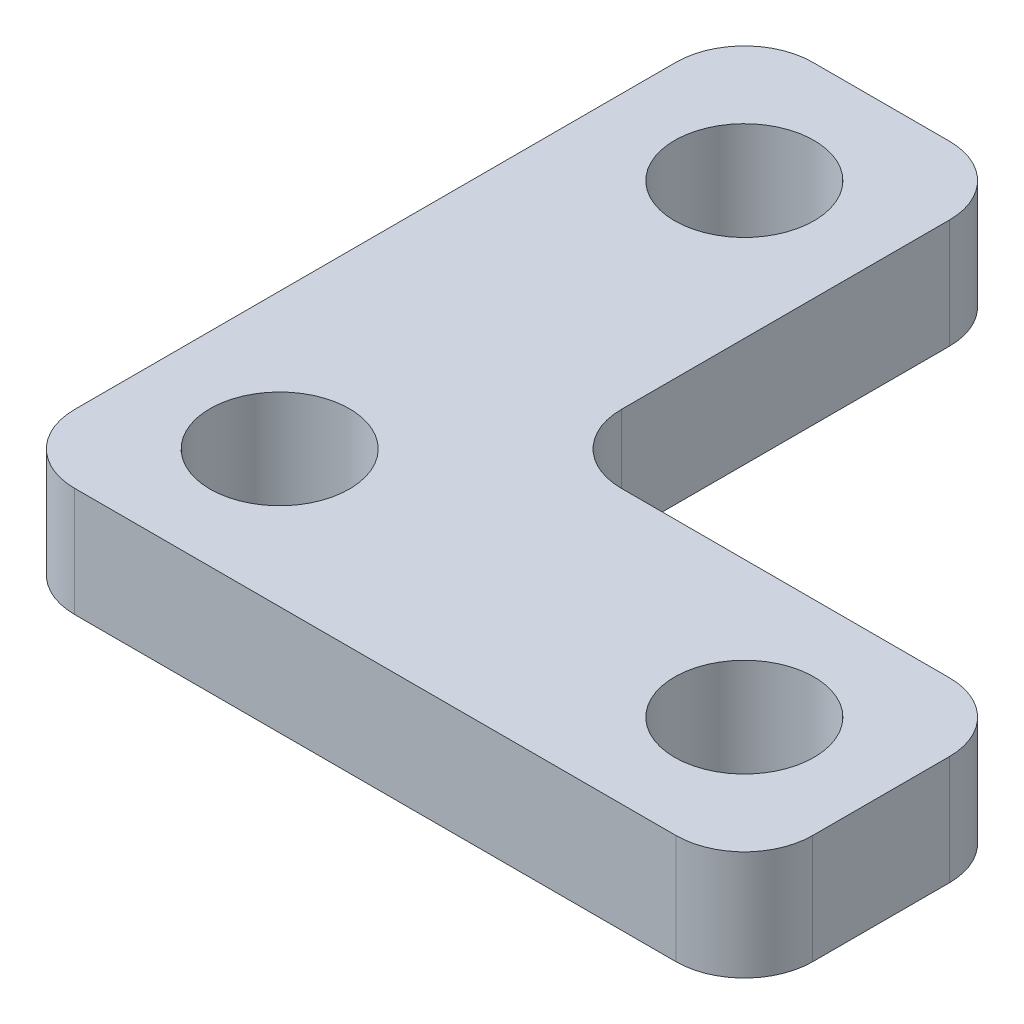
from build123d import *

# Parameters (mm, degrees)
SKETCH1_R           = 2.55
BOSS_EXTRUDE1_DEPTH = 4


with BuildPart() as part:
    # Sketch1 → Boss-Extrude1 (new body)
    with BuildSketch(Plane(origin=(0, 0, 0), x_dir=(1, 0, 0), z_dir=(0, 1, 0))):
        with BuildLine():
            Line((0, 2.5), (0, 24.5))
            ThreePointArc((0, 24.5), (0.732233047, 26.267766953), (2.5, 27))
            Line((2.5, 27), (7.5, 27))
            ThreePointArc((7.5, 27), (9.267766953, 26.267766953), (10, 24.5))
            Line((10, 24.5), (10, 12.5))
            ThreePointArc((10, 12.5), (10.732233047, 10.732233047), (12.5, 10))
            Line((12.5, 10), (24.5, 10))
            ThreePointArc((24.5, 10), (26.267766953, 9.267766953), (27, 7.5))
            Line((27, 7.5), (27, 2.5))
            ThreePointArc((27, 2.5), (26.267766953, 0.732233047), (24.5, 0))
            Line((24.5, 0), (2.5, 0))
            ThreePointArc((2.5, 0), (0.732233047, 0.732233047), (0, 2.5))
        make_face()
        with Locations((22, 5)):
            Circle(SKETCH1_R, mode=Mode.SUBTRACT)
        with Locations((5, 5)):
            Circle(SKETCH1_R, mode=Mode.SUBTRACT)
        with Locations((5, 22)):
            Circle(SKETCH1_R, mode=Mode.SUBTRACT)
    extrude(amount=BOSS_EXTRUDE1_DEPTH)


solid = part.part
